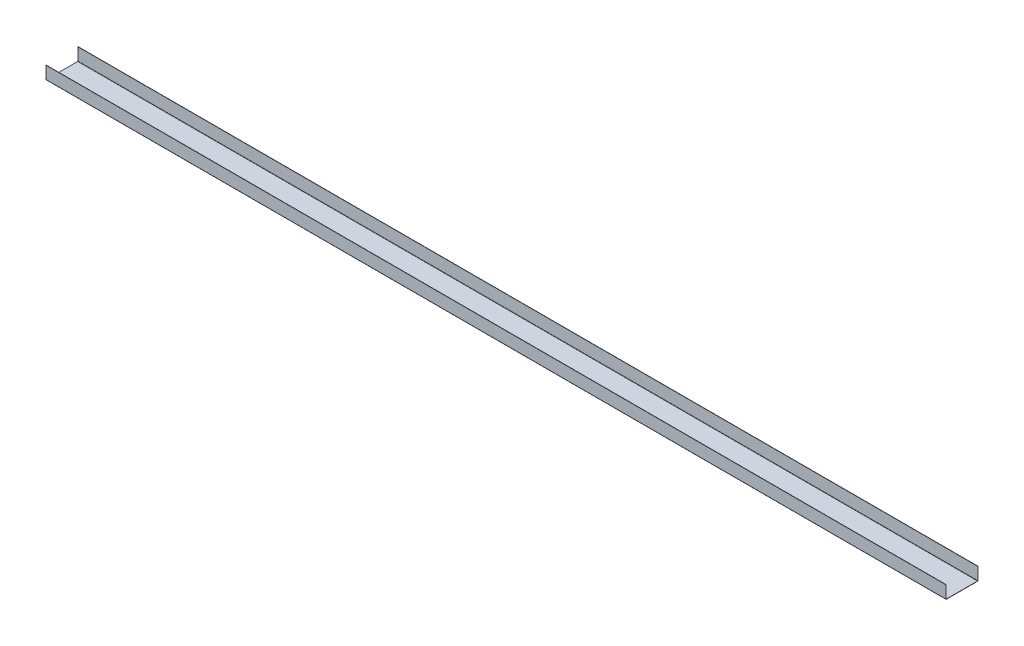
from build123d import *

# Parameters (mm, degrees)
SM_BASE_FLANGE_1_DEPTH = 2800


# Sheet-metal steps are written as plain solids
with BuildPart() as part:
    # Sketch 1 → Базовая кромка1 (new body)
    with BuildSketch(Plane(origin=(0, 0, 0), x_dir=(0, 0, -1), z_dir=(1, 0, 0))):
        with BuildLine():
            Line((-100, 40), (-100, 1.5))
            ThreePointArc((-100, 1.5), (-99.560660172, 0.439339828), (-98.5, 0))
            Line((-98.5, 0), (-1.5, 0))
            ThreePointArc((-1.5, 0), (-0.439339828, 0.439339828), (0, 1.5))
            Line((0, 1.5), (0, 40))
            Line((0, 40), (-0.75, 40))
            Line((-0.75, 40), (-0.75, 1.5))
            ThreePointArc((-0.75, 1.5), (-0.969669914, 0.969669914), (-1.5, 0.75))
            Line((-1.5, 0.75), (-98.5, 0.75))
            ThreePointArc((-98.5, 0.75), (-99.030330086, 0.969669914), (-99.25, 1.5))
            Line((-99.25, 1.5), (-99.25, 40))
            Line((-99.25, 40), (-100, 40))
        make_face()
    extrude(amount=SM_BASE_FLANGE_1_DEPTH)


solid = part.part
